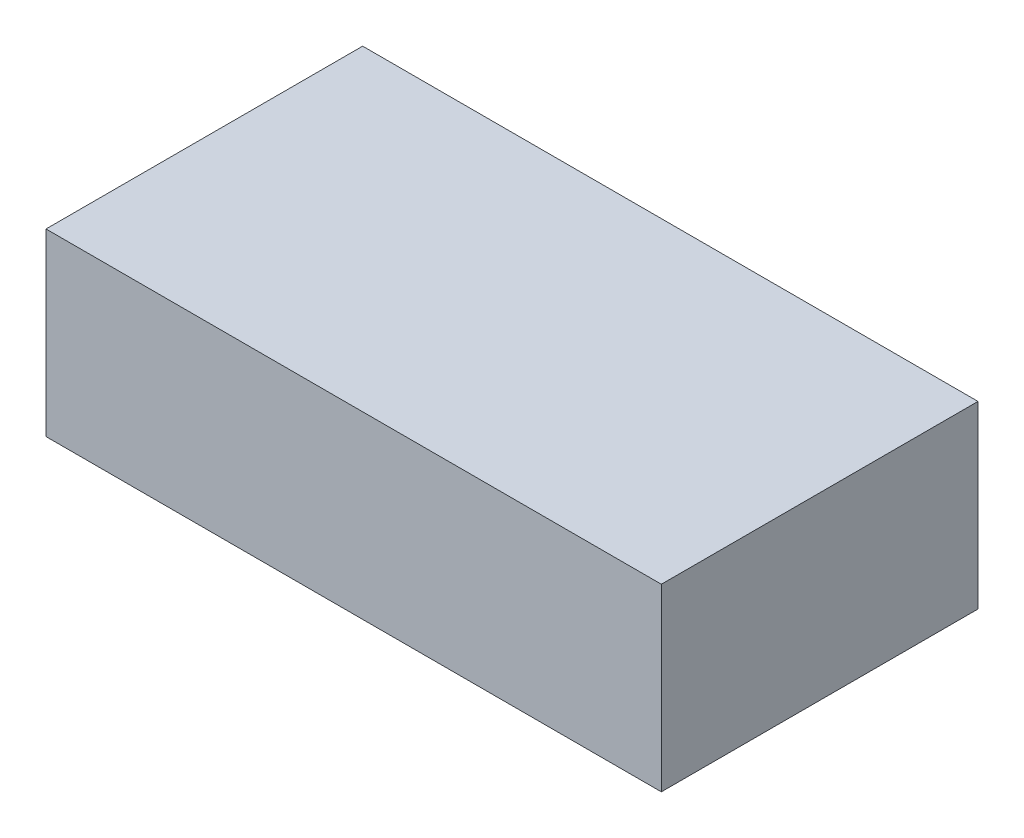
from build123d import *

# Parameters (mm, degrees)
SKETCH_1_W      = 19.432699573
SKETCH_1_H      = 5.678386239
EXTRUDE_1_DEPTH = 10


with BuildPart() as part:
    # Эскиз1 → Бобышка-Вытянуть1 (new body)
    with BuildSketch(Plane.XY):
        with Locations((9.716349787, -2.839193119)):
            Rectangle(SKETCH_1_W, SKETCH_1_H)
    extrude(amount=EXTRUDE_1_DEPTH)


solid = part.part
